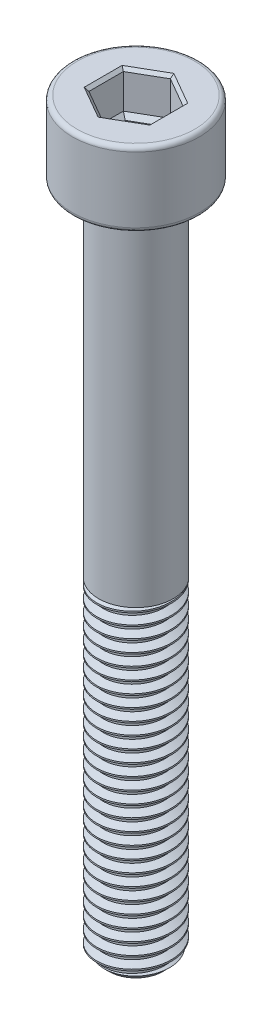
from build123d import *

# Parameters (mm, degrees)
SKETCH1_R           = 2.5
BOSS_EXTRUDE1_DEPTH = 22
THREAD1_PITCH       = 0.8
SKETCH2_R           = 2.5
BOSS_EXTRUDE2_DEPTH = 23
SKETCH3_R           = 4.25
BOSS_EXTRUDE3_DEPTH = 5
FILLET1_R           = 0.3
CUT_EXTRUDE1_DEPTH  = 2.5
CHAMFER1_SIZE       = 0.2
CUT_EXTRUDE2_DEPTH  = 0.3
CUT_EXTRUDE2_DRAFT  = -45


with BuildPart() as part:
    # Sketch1 → Boss-Extrude1 (new body)
    with BuildSketch(Plane(origin=(0, 0, 0), x_dir=(1, 0, 0), z_dir=(0, 1, 0))):
        with Locations(Location((0, 0, 0), (0, 0, 270))):
            Circle(SKETCH1_R)
    extrude(amount=BOSS_EXTRUDE1_DEPTH)

    # Thread1: arcs per turn and ends read off the stored shape
    # Thread1: the profile of Thread Profile1 profile screwed along a right-hand helix through 30 turns, 8 arcs to a turn; built about Z, then put on its axis
    thread1_z = Axis((0, 0, 0), (0, 0, 1))
    thread1_corners = [(2.5003, 0, -0.000173205), (2.5003, 0, 0.700173203), (2.0669873, 0, 0.449999999), (2.0669873, 0, 0.249999999)]
    with BuildLine(mode=Mode.PRIVATE) as thread1_profile:
        Line(thread1_corners[0], thread1_corners[1])
        Line(thread1_corners[1], thread1_corners[2])
        Line(thread1_corners[2], thread1_corners[3])
        Line(thread1_corners[3], thread1_corners[0])
    thread1_cap = Face(thread1_profile.wire())
    thread1_turn_angles = [0, 22.5, 45, 67.5, 90, 112.5, 135, 157.5, 180, 202.5, 225, 247.5, 270, 292.5, 315, 337.5, 360]
    thread1_turn_weights = [1, 0.9238795325112867, 1, 0.9238795325112867, 1, 0.9238795325112867, 1, 0.9238795325112867, 1, 0.9238795325112867, 1, 0.9238795325112867, 1, 0.9238795325112867, 1, 0.9238795325112867, 1]
    thread1_turn_rails = [Edge.make_bspline([Vector(p[0], p[1], 0).rotate(thread1_z, thread1_turn_angles[k]) / thread1_turn_weights[k] + Vector(0, 0, p[2] + THREAD1_PITCH * thread1_turn_angles[k] / 360) for k in range(17)], [0, 0, 0, 1, 1, 2, 2, 3, 3, 4, 4, 5, 5, 6, 6, 7, 7, 8, 8, 8], 2, thread1_turn_weights) for p in thread1_corners]
    thread1_turn_sides = [Face.make_surface_from_curves(thread1_turn_rails[p[0]], thread1_turn_rails[p[1]]) for p in [(0, 1), (1, 2), (2, 3), (3, 0)]]
    thread1 = Plane(origin=(0, 23, 0), x_dir=(-1, 0, 0), z_dir=(0, -1, 0)) * Solid(Shell([*[p.moved(Location((0, 0, THREAD1_PITCH * i))) for i in range(30) for p in thread1_turn_sides], thread1_cap, thread1_cap.rotate(thread1_z, 10800).moved(Location((0, 0, THREAD1_PITCH * 10800 / 360)))]))
    add(thread1, mode=Mode.SUBTRACT)

    # Sketch2 → Boss-Extrude2 (add)
    with BuildSketch(Plane(origin=(0, 22, 0), x_dir=(1, 0, 0), z_dir=(0, 1, 0))):
        with Locations(Location((0, 0, 0), (0, 0, 90))):
            Circle(SKETCH2_R)
    extrude(amount=BOSS_EXTRUDE2_DEPTH)

    # Sketch3 → Boss-Extrude3 (add)
    with BuildSketch(Plane(origin=(0, 45, 0), x_dir=(1, 0, 0), z_dir=(0, 1, 0))):
        with Locations(Location((0, 0, 0), (0, 0, 270))):
            Circle(SKETCH3_R)
    extrude(amount=BOSS_EXTRUDE3_DEPTH)

    # Fillet1
    fillet1_edges = [part.edges().sort_by_distance(p)[0] for p in [
        (0, 45, -4.25),
        (0, 50, -4.25),
    ]]
    fillet(fillet1_edges, radius=FILLET1_R)

    # Sketch4 → Cut-Revolve1 (revolve, cut)
    with BuildSketch(Plane.XY, mode=Mode.PRIVATE) as cut_revolve1_sk:
        Polygon((2.51, 0), (2.51, 0.7), (1.81, 0), align=None)
    revolve(cut_revolve1_sk.sketch.rotate(Axis((0, 0, 0), (0, 1, 0)), 90), axis=Axis((0, 0, 0), (0, 1, 0)), mode=Mode.SUBTRACT)

    # Sketch5 → Cut-Extrude1 (cut)
    with BuildSketch(Plane(origin=(0, 50, 0), x_dir=(1, 0, 0), z_dir=(0, 1, 0))):
        Polygon((0, 2.309401077), (-2, 1.154700538), (-2, -1.154700538), (0, -2.309401077), (2, -1.154700538), (2, 1.154700538), align=None)
    extrude(amount=-CUT_EXTRUDE1_DEPTH, mode=Mode.SUBTRACT)

    # Chamfer1
    chamfer1_edges = [part.edges().sort_by_distance(p)[0] for p in [
        (1, 50, -1.732050808),
        (-1, 50, -1.732050808),
        (-2, 50, 0),
        (-1, 50, 1.732050808),
        (1, 50, 1.732050808),
        (2, 50, 0),
    ]]
    chamfer(chamfer1_edges, length=CHAMFER1_SIZE)


with BuildPart() as cut_extrude2_tool:
    # Sketch6 → Cut-Extrude2 (with draft: the straight prism first)
    with BuildSketch(Plane(origin=(0, 47.5, 0), x_dir=(1, 0, 0), z_dir=(0, 1, 0))):
        Polygon((0, 2.309401077), (-2, 1.154700538), (-2, -1.154700538), (0, -2.309401077), (2, -1.154700538), (2, 1.154700538), align=None)
    extrude(amount=-CUT_EXTRUDE2_DEPTH)
    # Cut-Extrude2: the draft: its side faces are tilted about the plane it starts from
    cut_extrude2_sides = [cut_extrude2_tool.faces().sort_by_distance(p)[0] for p in [
        (-1, 47.35, -1.732050808),
        (-2, 47.35, 0),
        (-1, 47.35, 1.732050808),
        (1, 47.35, 1.732050808),
        (2, 47.35, 0),
        (1, 47.35, -1.732050808),
    ]]
    draft(cut_extrude2_sides, Plane(origin=(0, 47.5, 0), x_dir=(1, 0, 0), z_dir=(0, 1, 0)), CUT_EXTRUDE2_DRAFT)


with BuildPart() as part_1:
    add(part.part)

    # Cut-Extrude2: cut by cut_extrude2_tool
    add(cut_extrude2_tool.part, mode=Mode.SUBTRACT)


solid = part_1.part
